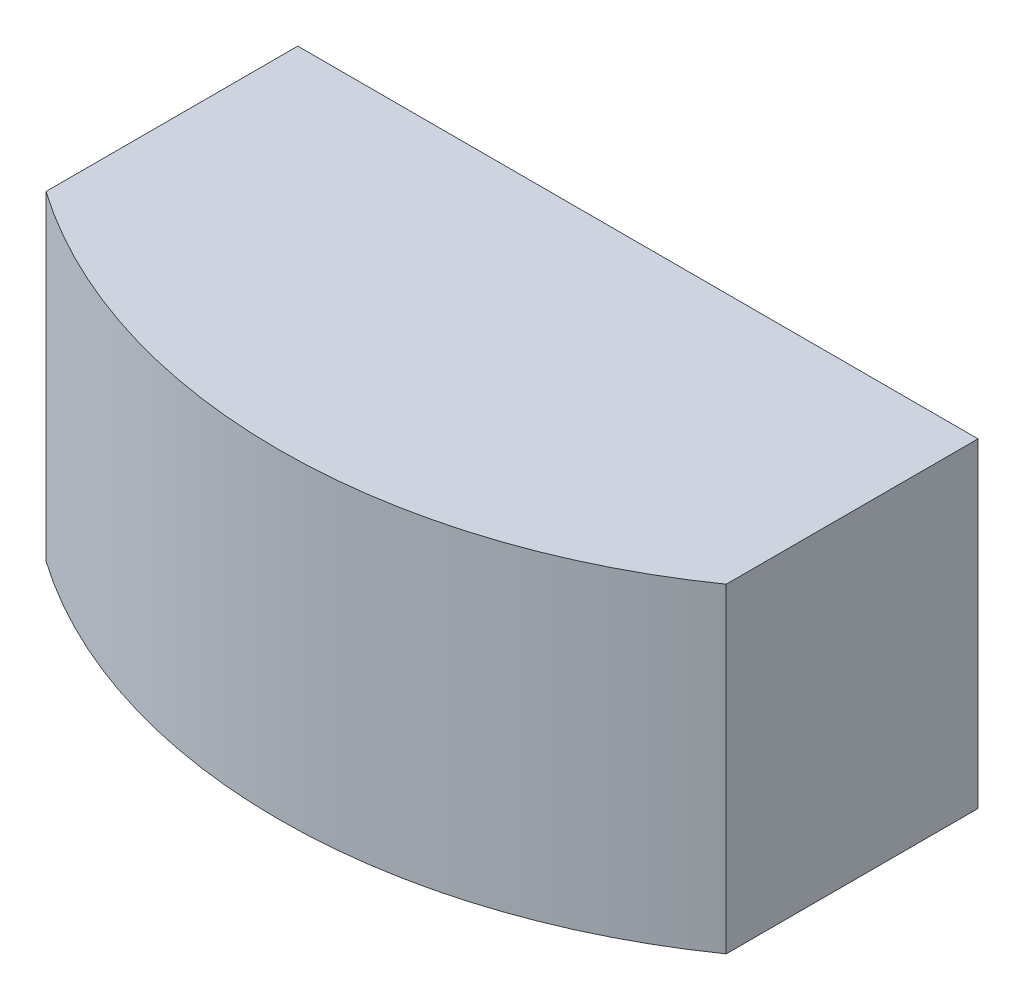
from build123d import *

# Parameters (mm, degrees)
EXTRUDE_START            = -329.393398282
EXTRUDE_1_DEPTH          = 367.123106012
CUT_EXTRUDE_2_REACH      = 654.668
CUT_EXTRUDE_2_END_RADIUS = 675
SKETCH_4_W               = 770
SKETCH_4_H               = 357.123106012


# Read off the part's stored shape, not the designer's step: 凸台-拉伸1
with BuildPart() as part:
    # 凸台-拉伸1 outline → 凸台-拉伸1 (new body)
    with BuildSketch(Plane(origin=(0, 0, 0), x_dir=(1, 0, 0), z_dir=(0, 1, 0)).offset(EXTRUDE_START)):
        with BuildLine():
            Line((390, -288.70946964), (390, 0))
            Line((390, 0), (-390, 0))
            Line((-390, 0), (-390, -288.70946964))
            ThreePointArc((-390, -288.70946964), (0, -411.663690552), (390, -288.70946964))
        make_face()
    extrude(amount=EXTRUDE_1_DEPTH)

    # 切除-拉伸2: up to this cylinder (the profile starts inside it)
    cut_extrude_2_end = Plane(origin=(0, -145.831845, -268.336309448), z_dir=(0, 1, 0)) * Cylinder(CUT_EXTRUDE_2_END_RADIUS, 2660.336, mode=Mode.PRIVATE)
    # 草图4 → 切除-拉伸2 (cut, up to the surface)
    with BuildSketch(Plane(origin=(0, 0, 5), x_dir=(-1, 0, 0), z_dir=(0, 0, -1)), mode=Mode.PRIVATE) as cut_extrude_2_sk1:
        with Locations((0, -145.831845276)):
            Rectangle(SKETCH_4_W, SKETCH_4_H)
    cut_extrude_2_tool1 = extrude(cut_extrude_2_sk1.sketch, amount=-CUT_EXTRUDE_2_REACH, mode=Mode.PRIVATE) & cut_extrude_2_end
    add(cut_extrude_2_tool1.solids().sort_by_distance((0, -145.831845, 5))[0], mode=Mode.SUBTRACT)


solid = part.part
